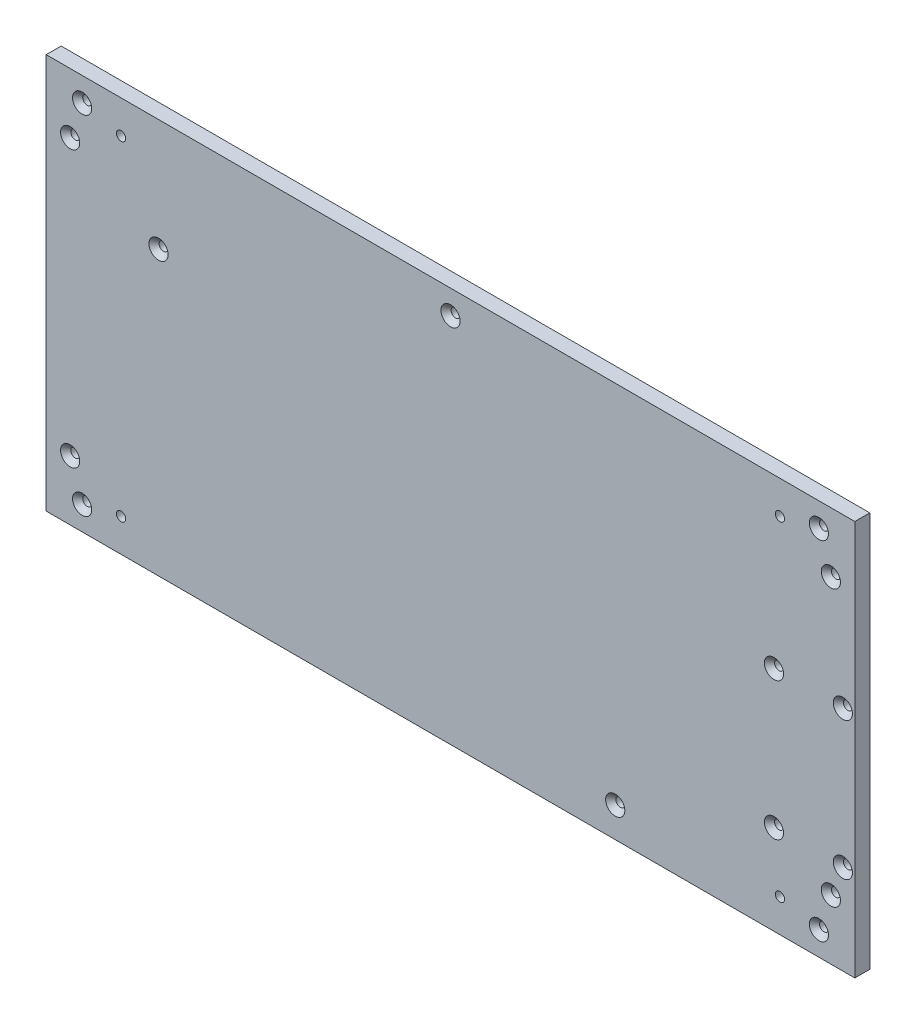
from build123d import *

# Parameters (mm, degrees)
SKETCH1_W            = 270
SKETCH1_H            = 132
BASE_DEPTH           = 2.5
SKETCH2_R            = 1.5
FASTENERSHOLES_DEPTH = 151.352918163
SKETCH3_R            = 1.5
CUT_EXTRUDE1_DEPTH   = 151.352918163
SKETCH4_R            = 1.5
INTERFACEHOLES_DEPTH = 151.352918163
CHAMFERALL_SIZE      = 1.7
SKETCH5_R            = 1.55
CUT_EXTRUDE2_DEPTH   = 151.352918163


with BuildPart() as part:
    # Sketch1 → Base (new, symmetric)
    with BuildSketch(Plane.XY):
        Rectangle(SKETCH1_W, SKETCH1_H)
    extrude(amount=BASE_DEPTH, both=True)

    # Sketch2 → FastenersHoles (cut, through all)
    with BuildSketch(Plane.XY.offset(2.5)):
        with Locations((-127, -46)):
            Circle(SKETCH2_R)
        with Locations((-123, -58)):
            Circle(SKETCH2_R)
        with Locations((-127, 46)):
            Circle(SKETCH2_R)
        with Locations((-123, 58)):
            Circle(SKETCH2_R)
        with Locations((0, 58)):
            Circle(SKETCH2_R)
        with Locations((123, -58)):
            Circle(SKETCH2_R)
        with Locations((127, -46)):
            Circle(SKETCH2_R)
        with Locations((127, 46)):
            Circle(SKETCH2_R)
        with Locations((123, 58)):
            Circle(SKETCH2_R)
    extrude(amount=-FASTENERSHOLES_DEPTH, mode=Mode.SUBTRACT)

    # Sketch3 → Cut-Extrude1 (cut, through all)
    with BuildSketch(Plane(origin=(0, 0, -2.5), x_dir=(-1, 0, 0), z_dir=(0, 0, -1))):
        with Locations((-55, -56)):
            Circle(SKETCH3_R)
        with Locations((97.5, 28.5)):
            Circle(SKETCH3_R)
    extrude(amount=-CUT_EXTRUDE1_DEPTH, mode=Mode.SUBTRACT)

    # Sketch4 → InterfaceHoles (cut, through all)
    with BuildSketch(Plane.XY.offset(2.5)):
        with Locations((108, 10)):
            Circle(SKETCH4_R)
        with Locations((131, 10)):
            Circle(SKETCH4_R)
        with Locations((108, -36)):
            Circle(SKETCH4_R)
        with Locations((131, -36)):
            Circle(SKETCH4_R)
    extrude(amount=-INTERFACEHOLES_DEPTH, mode=Mode.SUBTRACT)

    # ChamferAll
    chamferall_edges = [part.edges().sort_by_distance(p)[0] for p in [
        (56.5, -56, 2.5),
        (-124.5, -58, 2.5),
        (-128.5, -46, 2.5),
        (-124.5, 58, 2.5),
        (-128.5, 46, 2.5),
        (-96, 28.5, 2.5),
        (-1.5, 58, 2.5),
        (121.5, 58, 2.5),
        (125.5, 46, 2.5),
        (125.5, -46, 2.5),
        (121.5, -58, 2.5),
        (129.5, 10, 2.5),
        (129.5, -36, 2.5),
        (106.5, -36, 2.5),
        (106.5, 10, 2.5),
    ]]
    chamfer(chamferall_edges, length=CHAMFERALL_SIZE)

    # Sketch5 → Cut-Extrude2 (cut, through all)
    with BuildSketch(Plane.XY.offset(2.5)):
        with Locations((-110, -55)):
            Circle(SKETCH5_R)
        with Locations((-110, 55)):
            Circle(SKETCH5_R)
        with Locations((110, 55)):
            Circle(SKETCH5_R)
        with Locations((110, -55)):
            Circle(SKETCH5_R)
    extrude(amount=-CUT_EXTRUDE2_DEPTH, mode=Mode.SUBTRACT)


solid = part.part
